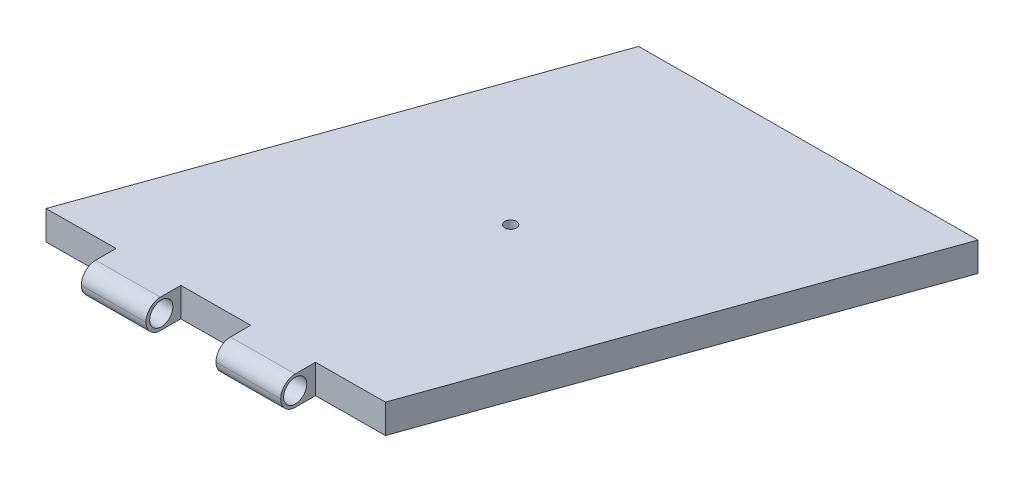
from build123d import *

# Parameters (mm, degrees)
BOSS_EXTRUDE1_DEPTH = 6.35
CUT_EXTRUDE1_DEPTH  = 145.787309477
SKETCH3_W           = 73.915341148
SKETCH3_H           = 6.35
BOSS_EXTRUDE2_DEPTH = 7.62
CUT_EXTRUDE2_DEPTH  = 145.787309477
FILLET1_R           = 3.175
SKETCH5_R           = 2.54
CUT_EXTRUDE3_DEPTH  = 113.806666284


with BuildPart() as part:
    # Sketch1 → Boss-Extrude1 (new body)
    with BuildSketch(Plane(origin=(0, 0, 0), x_dir=(1, 0, 0), z_dir=(0, 1, 0))):
        Polygon((0, 0), (34.173489324, 95.680366991), (108.087489324, 96.125632051), (73.914, 0.44526506), align=None)
    extrude(amount=BOSS_EXTRUDE1_DEPTH)

    # Sketch2 → Cut-Extrude1 (cut, through all)
    with BuildSketch(Plane(origin=(0, 6.35, 0), x_dir=(1, 0, 0), z_dir=(0, 1, 0))):
        with BuildLine():
            ThreePointArc((55.234228554, 47.840183495), (53.964228554, 49.110183495), (52.694228554, 47.840183495))
            Line((52.694228554, 47.840183495), (55.234228554, 47.840183495))
        make_face()
        with BuildLine():
            Line((55.234228554, 47.840183495), (52.694228554, 47.840183495))
            ThreePointArc((52.694228554, 47.840183495), (53.964228554, 46.570183495), (55.234228554, 47.840183495))
        make_face()
    extrude(amount=-CUT_EXTRUDE1_DEPTH, mode=Mode.SUBTRACT)

    # Sketch3 → Boss-Extrude2 (add)
    with BuildSketch(Plane(origin=(0, 0, 0), x_dir=(0.9999818556252084, 0, -0.00602398708207968), z_dir=(0.00602398708207968, 0, 0.9999818556252085))):
        with Locations((36.957670574, 3.175)):
            Rectangle(SKETCH3_W, SKETCH3_H)
    extrude(amount=BOSS_EXTRUDE2_DEPTH)

    # Sketch4 → Cut-Extrude2 (cut, through all)
    with BuildSketch(Plane(origin=(0, 6.35, 0), x_dir=(1, 0, 0), z_dir=(0, 1, 0))):
        Polygon((15.256454596, 0.091906353), (0, 0), (0.045902782, -7.61986174), (15.256454596, -7.52823191), align=None)
        Polygon((44.594795755, 0.268643348), (29.354795755, 0.176836119), (29.354795755, -7.443302144), (44.594795755, -7.351494915), align=None)
        Polygon((73.914, 0.44526506), (58.693136915, 0.353573114), (58.693136915, -7.266565149), (73.959902782, -7.17459668), align=None)
    extrude(amount=-CUT_EXTRUDE2_DEPTH, mode=Mode.SUBTRACT)

    # Fillet1
    fillet1_edges = [part.edges().sort_by_distance(p)[0] for p in [
        (51.643966335, 0, 7.309030032),
        (51.643966335, 6.35, 7.309030032),
        (22.305625176, 0, 7.485767027),
        (22.305625176, 6.35, 7.485767027),
    ]]
    fillet(fillet1_edges, radius=FILLET1_R - 0.0001)  # a hair under: the kernel refuses the full size

    # Sketch5 → Cut-Extrude3 (cut, through all)
    with BuildSketch(Plane(origin=(58.693136915, 0, 0), x_dir=(0, 0, -1), z_dir=(1, 0, 0))):
        with Locations((-4.091507539, 3.175)):
            Circle(SKETCH5_R)
    extrude(amount=-CUT_EXTRUDE3_DEPTH, mode=Mode.SUBTRACT)


solid = part.part
